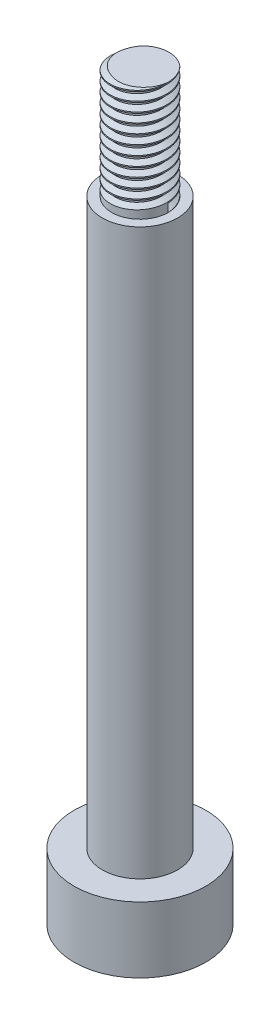
from build123d import *
from build123d.topology import SkipClean

# Parameters (mm, degrees)
SKETCH_1_R      = 3.5
EXTRUDE_1_DEPTH = 3.5
SKETCH_2_R      = 2
EXTRUDE_2_DEPTH = 30
SKETCH_3_R      = 1.5
EXTRUDE_3_DEPTH = 6
THREAD_1_PITCH  = 0.5


with BuildPart() as part:
    # Sketch 1 → 凸台-拉伸1 (new body)
    with BuildSketch(Plane(origin=(0, 0, 0), x_dir=(1, 0, 0), z_dir=(0, 1, 0))):
        with Locations(Location((0, 0, 0), (0, 0, 270))):
            Circle(SKETCH_1_R)
    extrude(amount=EXTRUDE_1_DEPTH)

    # 草图2 → 凸台-拉伸2 (add)
    with BuildSketch(Plane(origin=(0, 3.5, 0), x_dir=(1, 0, 0), z_dir=(0, 1, 0))):
        with Locations(Location((0, 0, 0), (0, 0, 270))):
            Circle(SKETCH_2_R)
    extrude(amount=EXTRUDE_2_DEPTH)

    # 草图3 → 凸台-拉伸3 (add)
    with BuildSketch(Plane(origin=(0, 33.5, 0), x_dir=(1, 0, 0), z_dir=(0, 1, 0))):
        with Locations(Location((0, 0, 0), (0, 0, 270))):
            Circle(SKETCH_3_R)
    extrude(amount=EXTRUDE_3_DEPTH)

    # 螺纹线1: the profile of Sketch 1 2 profile screwed along a right-hand helix of 20 turns, 6 arcs to a turn; built about Z, then put on its axis
    with SkipClean():  # the faces are left unmerged after this step: merging them gives an invalid solid
        thread_1_z = Axis((0, 0, 0), (0, 0, 1))
        thread_1_corners = [(1.5003, 0, -0.000173205), (1.5003, 0, 0.437673204), (1.229367063, 0, 0.281249999), (1.229367063, 0, 0.156249999)]
        with BuildLine(mode=Mode.PRIVATE) as thread_1_profile:
            Line(thread_1_corners[0], thread_1_corners[1])
            Line(thread_1_corners[1], thread_1_corners[2])
            Line(thread_1_corners[2], thread_1_corners[3])
            Line(thread_1_corners[3], thread_1_corners[0])
        thread_1_cap = Face(thread_1_profile.wire())
        thread_1_turn_angles = [0, 30, 60, 90, 120, 150, 180, 210, 240, 270, 300, 330, 360]
        thread_1_turn_weights = [1, 0.8660254037844387, 1, 0.8660254037844387, 1, 0.8660254037844387, 1, 0.8660254037844387, 1, 0.8660254037844387, 1, 0.8660254037844387, 1]
        thread_1_turn_rails = [Edge.make_bspline([Vector(p[0], p[1], 0).rotate(thread_1_z, thread_1_turn_angles[k]) / thread_1_turn_weights[k] + Vector(0, 0, p[2] + THREAD_1_PITCH * thread_1_turn_angles[k] / 360) for k in range(13)], [0, 0, 0, 1, 1, 2, 2, 3, 3, 4, 4, 5, 5, 6, 6, 6], 2, thread_1_turn_weights) for p in thread_1_corners]
        thread_1_turn_sides = [Face.make_surface_from_curves(thread_1_turn_rails[p[0]], thread_1_turn_rails[p[1]]) for p in [(0, 1), (1, 2), (2, 3), (3, 0)]]
        thread_1 = Plane(origin=(0, 33.5, 0), x_dir=(1, 0, 0), z_dir=(0, 1, 0)) * Solid(Shell([*[p.moved(Location((0, 0, THREAD_1_PITCH * i))) for i in range(20) for p in thread_1_turn_sides], thread_1_cap, thread_1_cap.rotate(thread_1_z, 7200).moved(Location((0, 0, THREAD_1_PITCH * 7200 / 360)))]))
        add(thread_1, mode=Mode.SUBTRACT)


solid = part.part
